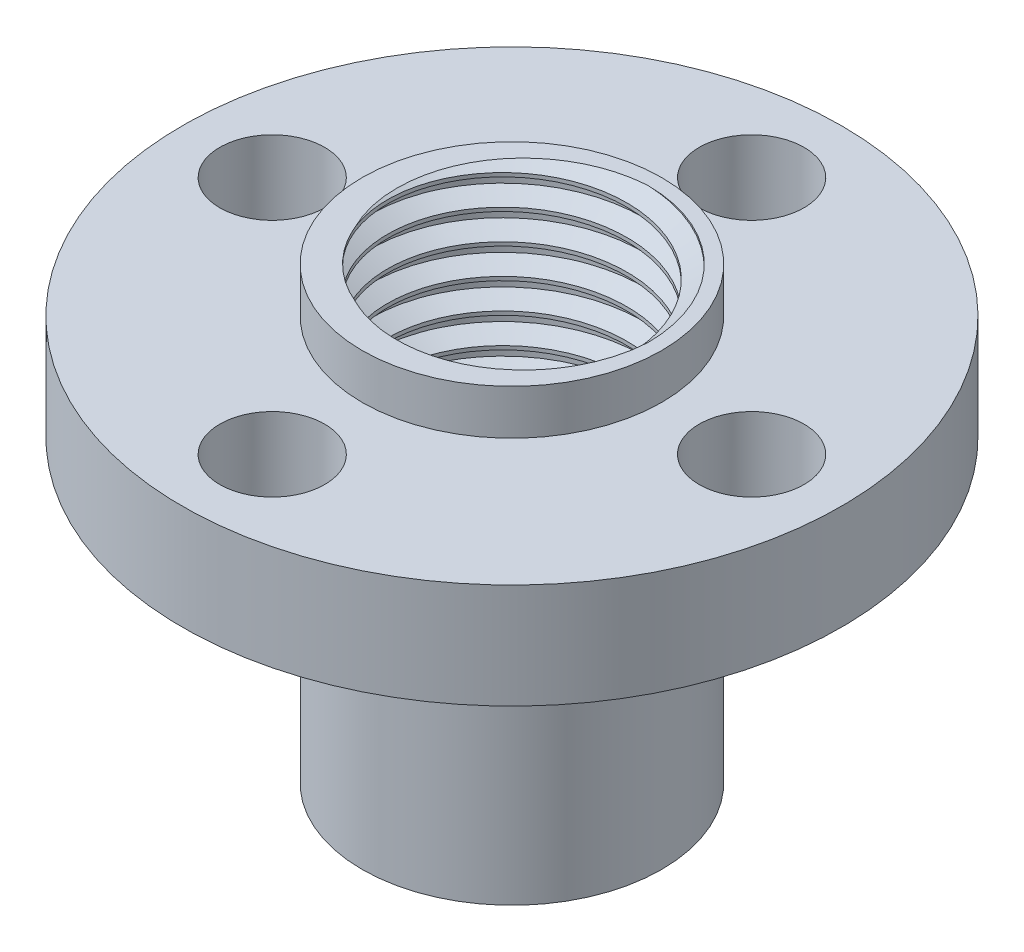
from build123d import *
from build123d.topology import SkipClean

# Parameters (mm, degrees)
SKETCH1_R           = 5
SKETCH1_R_2         = 4.54
BOSS_EXTRUDE1_DEPTH = 1.5
BOSS_EXTRUDE4_START = 3.5
SKETCH11_R          = 11
SKETCH11_R_2        = 4.54
BOSS_EXTRUDE4_DEPTH = 3.5
BOSS_EXTRUDE5_START = 10
SKETCH12_R          = 5
SKETCH12_R_2        = 4.54
BOSS_EXTRUDE5_DEPTH = 10
THREAD1_PITCH       = 1
SKETCH16_R          = 6.118671707
CUT_EXTRUDE1_DEPTH  = 4
SKETCH17_R          = 6.541501419
CUT_EXTRUDE2_DEPTH  = 5
SKETCH18_R          = 1.75
CUT_EXTRUDE3_DEPTH  = 5


with BuildPart() as part:
    # Sketch1 → Boss-Extrude1 (new body)
    with BuildSketch(Plane(origin=(0, 0, 0), x_dir=(1, 0, 0), z_dir=(0, 1, 0))):
        with Locations(Location((0, 0, 0), (0, 0, 270))):
            Circle(SKETCH1_R)
        with Locations(Location((0, 0, 0), (0, 0, 270))):
            Circle(SKETCH1_R_2, mode=Mode.SUBTRACT)
    extrude(amount=BOSS_EXTRUDE1_DEPTH)

    # Sketch11 → Boss-Extrude4 (add)
    with SkipClean():  # the faces are left unmerged after this step: merging them gives an invalid solid
        with BuildSketch(Plane.XZ.offset(BOSS_EXTRUDE4_START)):
            with Locations(Location((0, 0, 0), (0, 0, 270))):
                Circle(SKETCH11_R)
            with Locations(Location((0, 0, 0), (0, 0, 270))):
                Circle(SKETCH11_R_2, mode=Mode.SUBTRACT)
        extrude(amount=-BOSS_EXTRUDE4_DEPTH)

    # Sketch12 → Boss-Extrude5 (add)
    with SkipClean():  # the faces are left unmerged after this step: merging them gives an invalid solid
        with BuildSketch(Plane.XZ.offset(3.5).offset(BOSS_EXTRUDE5_START)):
            with Locations(Location((0, 0, 0), (0, 0, 270))):
                Circle(SKETCH12_R)
            with Locations(Location((0, 0, 0), (0, 0, 270))):
                Circle(SKETCH12_R_2, mode=Mode.SUBTRACT)
        extrude(amount=-BOSS_EXTRUDE5_DEPTH)

    # Thread1: the profile of Thread Profile2 profile screwed along a right-hand helix of 16 turns, 8 arcs to a turn; built about Z, then put on its axis
    thread1_z = Axis((0, 0, 0), (0, 0, 1))
    thread1_corners = [(4.5403, 0, 0.750173208), (3.99873412, 0, 0.437500002), (3.99873412, 0, 0.312500002), (4.5403, 0, -0.000173205)]
    with BuildLine(mode=Mode.PRIVATE) as thread1_profile:
        Line(thread1_corners[0], thread1_corners[1])
        Line(thread1_corners[1], thread1_corners[2])
        Line(thread1_corners[2], thread1_corners[3])
        Line(thread1_corners[3], thread1_corners[0])
    thread1_cap = Face(thread1_profile.wire())
    thread1_turn_angles = [0, 22.5, 45, 67.5, 90, 112.5, 135, 157.5, 180, 202.5, 225, 247.5, 270, 292.5, 315, 337.5, 360]
    thread1_turn_weights = [1, 0.9238795325112867, 1, 0.9238795325112867, 1, 0.9238795325112867, 1, 0.9238795325112867, 1, 0.9238795325112867, 1, 0.9238795325112867, 1, 0.9238795325112867, 1, 0.9238795325112867, 1]
    thread1_turn_rails = [Edge.make_bspline([Vector(p[0], p[1], 0).rotate(thread1_z, thread1_turn_angles[k]) / thread1_turn_weights[k] + Vector(0, 0, p[2] + THREAD1_PITCH * thread1_turn_angles[k] / 360) for k in range(17)], [0, 0, 0, 1, 1, 2, 2, 3, 3, 4, 4, 5, 5, 6, 6, 7, 7, 8, 8, 8], 2, thread1_turn_weights) for p in thread1_corners]
    thread1_turn_sides = [Face.make_surface_from_curves(thread1_turn_rails[p[0]], thread1_turn_rails[p[1]]) for p in [(0, 1), (1, 2), (2, 3), (3, 0)]]
    thread1 = Plane(origin=(0, -14.5, 0), x_dir=(1, 0, 0), z_dir=(0, 1, 0)) * Solid(Shell([*[p.moved(Location((0, 0, THREAD1_PITCH * i))) for i in range(16) for p in thread1_turn_sides], thread1_cap, thread1_cap.rotate(thread1_z, 5760).moved(Location((0, 0, THREAD1_PITCH * 5760 / 360)))]))
    add(thread1)

    # Sketch16 → Cut-Extrude1 (cut)
    with BuildSketch(Plane(origin=(0, 1.5, 0), x_dir=(1, 0, 0), z_dir=(0, 1, 0))):
        Circle(SKETCH16_R)
    extrude(amount=CUT_EXTRUDE1_DEPTH, mode=Mode.SUBTRACT)

    # Sketch17 → Cut-Extrude2 (cut)
    with BuildSketch(Plane.XZ.offset(13.5)):
        Circle(SKETCH17_R)
    extrude(amount=CUT_EXTRUDE2_DEPTH, mode=Mode.SUBTRACT)

    # Sketch18 → Cut-Extrude3 (cut)
    with BuildSketch(Plane(origin=(0, 0, 0), x_dir=(1, 0, 0), z_dir=(0, 1, 0))):
        with Locations(Location((0, 8, 0), (0, 0, 270))):
            Circle(SKETCH18_R)
        with Locations(Location((8, 0, 0), (0, 0, 270))):
            Circle(SKETCH18_R)
        with Locations(Location((0, -8, 0), (0, 0, 270))):
            Circle(SKETCH18_R)
        with Locations(Location((-8, 0, 0), (0, 0, 270))):
            Circle(SKETCH18_R)
    extrude(amount=-CUT_EXTRUDE3_DEPTH, mode=Mode.SUBTRACT)


solid = part.part
